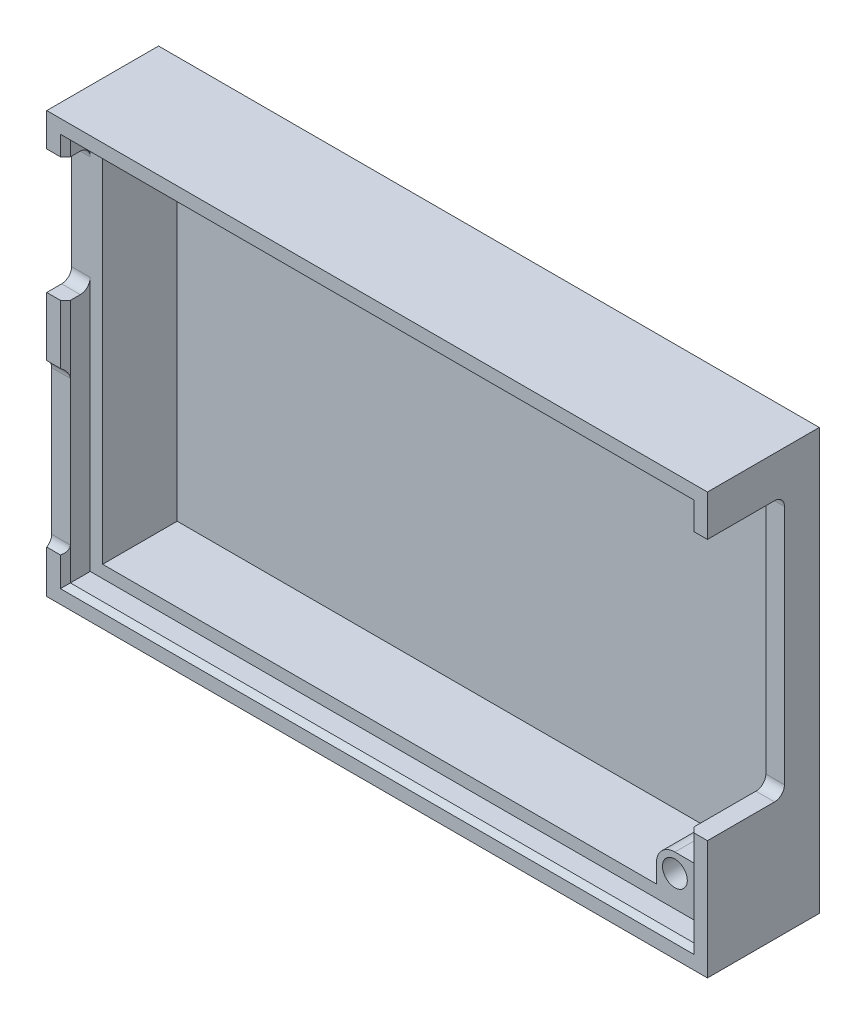
from build123d import *

# Parameters (mm, degrees)
EXTRUDE_1_DEPTH     = 1
SKETCH_1_R          = 1
EXTRUDE_1_2_DEPTH   = 1
SKETCH_1_3_R        = 1.486
SKETCH_1_3_R_2      = 1
EXTRUDE_2_DEPTH     = 7
SKETCH_1_4_W        = 53.184
SKETCH_1_4_H        = 33.88
SKETCH_1_4_W_2      = 50.184
SKETCH_1_4_H_2      = 30.88
EXTRUDE_3_DEPTH     = 9
SKETCH_2_W          = 6.2
SKETCH_2_H          = 21
CUT_EXTRUDE_1_DEPTH = 62.545010001
SKETCH_3_W          = 2
SKETCH_3_H          = 10
CUT_EXTRUDE_2_DEPTH = 62.545010001
SKETCH_4_W          = 0.4
SKETCH_4_H          = 13
CUT_EXTRUDE_3_DEPTH = 62.545010001
FILLET_1_R          = 0.8
CHAMFER_1_SIZE      = 0.4


# Some blends are built 0.0001 mm under size
with BuildPart() as part:
    # Эскиз1 → Бобышка-Вытянуть1 (new body)
    with BuildSketch(Plane.XY):
        with BuildLine():
            Line((48.984, 3.772), (48.984, 6))
            Line((48.984, 6), (49.984, 6))
            Line((49.984, 6), (49.984, 29.68))
            Line((49.984, 29.68), (0.8, 29.68))
            Line((0.8, 29.68), (0.8, 0.8))
            Line((0.8, 0.8), (45.377, 0.8))
            Line((45.377, 0.8), (45.377, 2.286))
            ThreePointArc((45.377, 2.286), (45.812239323, 3.336760677), (46.863, 3.772))
            Line((46.863, 3.772), (48.984, 3.772))
        make_face()
    extrude(amount=EXTRUDE_1_DEPTH)



with BuildPart() as body_2:
    # Эскиз1 → Extrude 1 2 (new body)
    with BuildSketch(Plane.XY):
        with Locations((46.863, 2.286)):
            Circle(SKETCH_1_R)
    extrude(amount=EXTRUDE_1_2_DEPTH)


with BuildPart() as part_1:
    add(part.part)

    add(body_2.part)  # Бобышка-Вытянуть2 merges body 2
    # Эскиз1<3> → Бобышка-Вытянуть2 (add)
    # profile 1 of 4: a face of its own
    with BuildSketch(Plane.XY):
        Polygon((0.8, 29.68), (48.984, 29.68), (49.984, 29.68), (49.984, 30.68), (-0.2, 30.68), (-0.2, -0.2), (49.984, -0.2), (49.984, 6), (48.984, 6), (48.984, 3.772), (48.984, 0.8), (46.863, 0.8), (45.377, 0.8), (0.8, 0.8), align=None)
    # profile 2 of 4: a face of its own
    with BuildSketch(Plane.XY):
        with BuildLine():
            Line((48.984, 0.8), (48.984, 3.772))
            Line((48.984, 3.772), (46.863, 3.772))
            ThreePointArc((46.863, 3.772), (47.913760677, 3.336760677), (48.349, 2.286))
            ThreePointArc((48.349, 2.286), (47.913760677, 1.235239323), (46.863, 0.8))
            Line((46.863, 0.8), (48.984, 0.8))
        make_face()
    # profile 3 of 4: a face of its own
    with BuildSketch(Plane.XY):
        with BuildLine():
            Line((45.377, 2.286), (45.377, 0.8))
            Line((45.377, 0.8), (46.863, 0.8))
            ThreePointArc((46.863, 0.8), (45.812239323, 1.235239323), (45.377, 2.286))
        make_face()
    # profile 4 of 4: a face of its own
    with BuildSketch(Plane.XY):
        with Locations((46.863, 2.286)):
            Circle(SKETCH_1_3_R)
        with Locations((46.863, 2.286)):
            Circle(SKETCH_1_3_R_2, mode=Mode.SUBTRACT)
    extrude(amount=EXTRUDE_2_DEPTH)

    # Эскиз1<4> → Бобышка-Вытянуть3 (add)
    with BuildSketch(Plane.XY):
        with Locations((24.892, 15.24)):
            Rectangle(SKETCH_1_4_W, SKETCH_1_4_H)
        with Locations((24.892, 15.24)):
            Rectangle(SKETCH_1_4_W_2, SKETCH_1_4_H_2, mode=Mode.SUBTRACT)
    extrude(amount=EXTRUDE_3_DEPTH)

    # Эскиз2 → Вырез-Вытянуть1 (cut, through all)
    with BuildSketch(Plane.ZY.offset(-49.984)):
        with Locations((5.9, 18.374)):
            Rectangle(SKETCH_2_W, SKETCH_2_H)
    extrude(amount=-CUT_EXTRUDE_1_DEPTH, mode=Mode.SUBTRACT)

    # Эскиз3 → Вырез-Вытянуть2 (cut, through all)
    with BuildSketch(Plane(origin=(-0.2, 0, 0), x_dir=(0, 0, -1), z_dir=(1, 0, 0))):
        with Locations((-8, 24.5)):
            Rectangle(SKETCH_3_W, SKETCH_3_H)
    extrude(amount=-CUT_EXTRUDE_2_DEPTH, mode=Mode.SUBTRACT)

    # Эскиз4 → Вырез-Вытянуть3 (cut, through all)
    with BuildSketch(Plane(origin=(-0.2, 0, 0), x_dir=(0, 0, -1), z_dir=(1, 0, 0))):
        with Locations((-8.8, 8.25)):
            Rectangle(SKETCH_4_W, SKETCH_4_H)
    extrude(amount=-CUT_EXTRUDE_3_DEPTH, mode=Mode.SUBTRACT)

    # Скругление1
    # the kernel refuses this fillet: 0.8 mm, written as the material it adds along each edge
    with BuildSketch(Plane(origin=(49.984, 7.874, 2.8), x_dir=(0, 1, 0), z_dir=(1, 0, 0)), Plane(origin=(49.984, 28.874, 2.8), x_dir=(0, 0, 1), z_dir=(1, 0, 0)), Plane(origin=(-0.2, 19.5, 7), x_dir=(0, 0, 1), z_dir=(-1, 0, 0)), Plane(origin=(-0.2, 29.5, 7), x_dir=(0, -1, 0), z_dir=(-1, 0, 0))) as fillet_1_piece_1:
        with BuildLine():
            CenterArc((FILLET_1_R, FILLET_1_R), FILLET_1_R, 180, 90)
            Line((0, FILLET_1_R), (-FILLET_1_R * 0.02, FILLET_1_R))
            Line((-FILLET_1_R * 0.02, FILLET_1_R), (-FILLET_1_R * 0.02, -FILLET_1_R * 0.02))
            Line((-FILLET_1_R * 0.02, -FILLET_1_R * 0.02), (FILLET_1_R, -FILLET_1_R * 0.02))
            Line((FILLET_1_R, -FILLET_1_R * 0.02), (FILLET_1_R, 0))
        make_face()
    extrude(amount=1.5)
    with BuildSketch(Plane(origin=(-0.2, 1.75, 8.6), x_dir=(0, 0, 1), z_dir=(-1, 0, 0))) as fillet_1_piece_2:
        with BuildLine():
            CenterArc((0.8, 0.692820323), FILLET_1_R, 180, 60)
            Line((0, 0.692820323), (-0.016, 0.692820323))
            Line((-0.016, 0.692820323), (-0.016, 0))
            Line((-0.016, 0), (0, -0.016))
            ThreePointArc((0, -0.016), (0.2, -0.016), (0.392, -0.013856406))
            Line((0.392, -0.013856406), (0.4, 0))
        make_face()
    extrude(amount=1.5)
    with BuildSketch(Plane(origin=(-0.2, 14.75, 8.6), x_dir=(0, -1, 0), z_dir=(-1, 0, 0))) as fillet_1_piece_3:
        with BuildLine():
            CenterArc((0.692820323, 0.8), FILLET_1_R, 210, 60)
            Line((0, 0.4), (-0.013856406, 0.392))
            ThreePointArc((-0.013856406, 0.392), (-0.016, 0.2), (-0.016, 0))
            Line((-0.016, 0), (0, -0.016))
            Line((0, -0.016), (0.692820323, -0.016))
            Line((0.692820323, -0.016), (0.692820323, 0))
        make_face()
    extrude(amount=1.5)

    # Фаска1
    chamfer_1_edges = [part_1.edges().sort_by_distance(p)[0] for p in [
        (-0.2, 17.125, 9),
        (-0.2, 0.775, 9),
        (24.892, -0.2, 9),
        (49.984, 3.837, 9),
        (49.984, 29.777, 9),
        (24.892, 30.68, 9),
        (-0.2, 30.09, 9),
    ]]
    chamfer(chamfer_1_edges, length=CHAMFER_1_SIZE - 0.0001)  # a hair under: the kernel refuses the full size


solid = part_1.part
